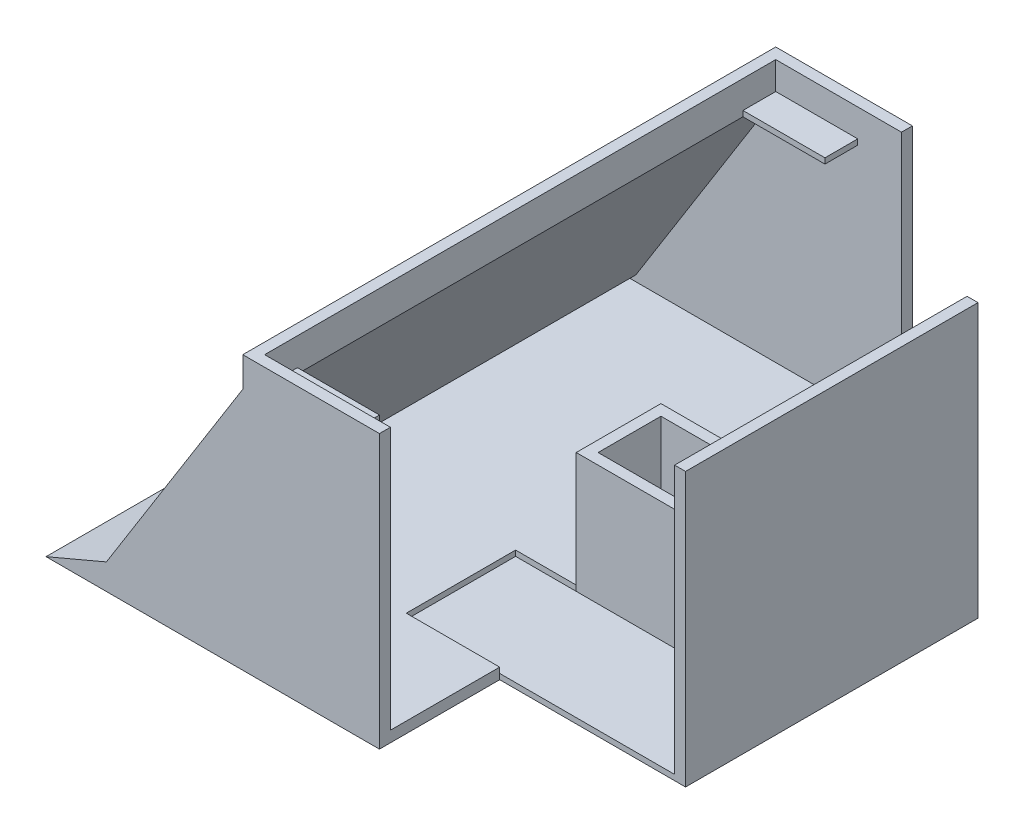
from build123d import *

# Parameters (mm, degrees)
SALIENTE_EXTRUIR1_DEPTH    = 97.5
VACIADO1_T                 = -2
CORTAR_EXTRUIR1_DEPTH      = 146.020714686
CORTAR_EXTRUIR1_DEPTH_BACK = 146.020714686
CROQUIS2_W                 = 34
CROQUIS2_H                 = 22
CROQUIS5_W                 = 37
CROQUIS5_H                 = 15.5
SALIENTE_EXTRUIR3_DEPTH    = 22
CROQUIS7_R                 = 4.75
CORTAR_EXTRUIR2_DEPTH      = 22
VACIADO2_START             = 43
VACIADO2_OUTLINE_W         = 35
VACIADO2_OUTLINE_H         = 22
VACIADO2_OUTLINE_R         = 6.75
VACIADO2_DEPTH             = 11.5
CROQUIS9_W                 = 49.09
CROQUIS9_H                 = 20
CORTAR_EXTRUIR3_DEPTH      = 1
CROQUIS11_W                = 15
CROQUIS11_H                = 1
SALIENTE_EXTRUIR7_DEPTH    = 6
CROQUIS15_W                = 15
CROQUIS15_H                = 1
SALIENTE_EXTRUIR8_DEPTH    = 6


# Read off the part's stored shape, not the designer's step: Vaciado2
with BuildPart() as part:
    # Croquis1 → Saliente-Extruir1 (new body)
    with BuildSketch(Plane.XY):
        Polygon((0, 0), (94.998724665, 0), (94.998724665, 50), (35.998724665, 50), (35.998724665, 44.517964324), (11.046058241, 4.688773542), align=None)
    extrude(amount=SALIENTE_EXTRUIR1_DEPTH)

    # Vaciado1
    vaciado1_openings = [part.faces().sort_by_distance(p)[0] for p in [
        (65.498724665, 50, 48.75),
    ]]
    offset(amount=VACIADO1_T, openings=vaciado1_openings, kind=Kind.INTERSECTION)

    # Croquis2 → Cortar-Extruir1 (cut, two sides: drawn at the far end of the back side and taken through both)
    with BuildSketch(Plane(origin=(0, 50, 0), x_dir=(1, 0, 0), z_dir=(0, 1, 0)).offset(-CORTAR_EXTRUIR1_DEPTH_BACK)):
        with Locations((77.998724665, -11)):
            Rectangle(CROQUIS2_W, CROQUIS2_H)
        with Locations((77.998724665, -86.5)):
            Rectangle(CROQUIS2_W, CROQUIS2_H)
    extrude(amount=CORTAR_EXTRUIR1_DEPTH + CORTAR_EXTRUIR1_DEPTH_BACK, mode=Mode.SUBTRACT)

    # Croquis5 → Saliente-Extruir3 (add)
    with BuildSketch(Plane(origin=(0, 2, 0), x_dir=(1, 0, 0), z_dir=(0, 1, 0))):
        with Locations((74.498724665, -48.75)):
            Rectangle(CROQUIS5_W, CROQUIS5_H)
    extrude(amount=SALIENTE_EXTRUIR3_DEPTH)

    # Croquis7 → Cortar-Extruir2 (cut)
    with BuildSketch(Plane.XY.offset(56.5)):
        with Locations((82.778724665, 13.15)):
            Circle(CROQUIS7_R)
    extrude(amount=-CORTAR_EXTRUIR2_DEPTH, mode=Mode.SUBTRACT)

    # Vaciado2 outline → Vaciado2 (cut)
    with BuildSketch(Plane.XY.offset(VACIADO2_START)):
        with Locations((75.498724665, 13)):
            Rectangle(VACIADO2_OUTLINE_W, VACIADO2_OUTLINE_H)
        with Locations((82.778724665, 13.15)):
            Circle(VACIADO2_OUTLINE_R, mode=Mode.SUBTRACT)
    extrude(amount=VACIADO2_DEPTH, mode=Mode.SUBTRACT)

    # Croquis9 → Cortar-Extruir3 (cut)
    with BuildSketch(Plane(origin=(0, 2, 0), x_dir=(1, 0, 0), z_dir=(0, 1, 0))):
        with Locations((68.453724665, -32)):
            Rectangle(CROQUIS9_W, CROQUIS9_H)
        with Locations((68.453724665, -65.5)):
            Rectangle(CROQUIS9_W, CROQUIS9_H)
    extrude(amount=-CORTAR_EXTRUIR3_DEPTH, mode=Mode.SUBTRACT)

    # Croquis11 → Saliente-Extruir7 (add)
    with BuildSketch(Plane(origin=(0, 0, 95.5), x_dir=(-1, 0, 0), z_dir=(0, 0, -1))):
        with Locations((-45.498724665, 44.443211382)):
            Rectangle(CROQUIS11_W, CROQUIS11_H)
    extrude(amount=SALIENTE_EXTRUIR7_DEPTH)

    # Croquis15 → Saliente-Extruir8 (add)
    with BuildSketch(Plane.XY.offset(2)):
        with Locations((45.498724665, 44.44)):
            Rectangle(CROQUIS15_W, CROQUIS15_H)
    extrude(amount=SALIENTE_EXTRUIR8_DEPTH)


solid = part.part
